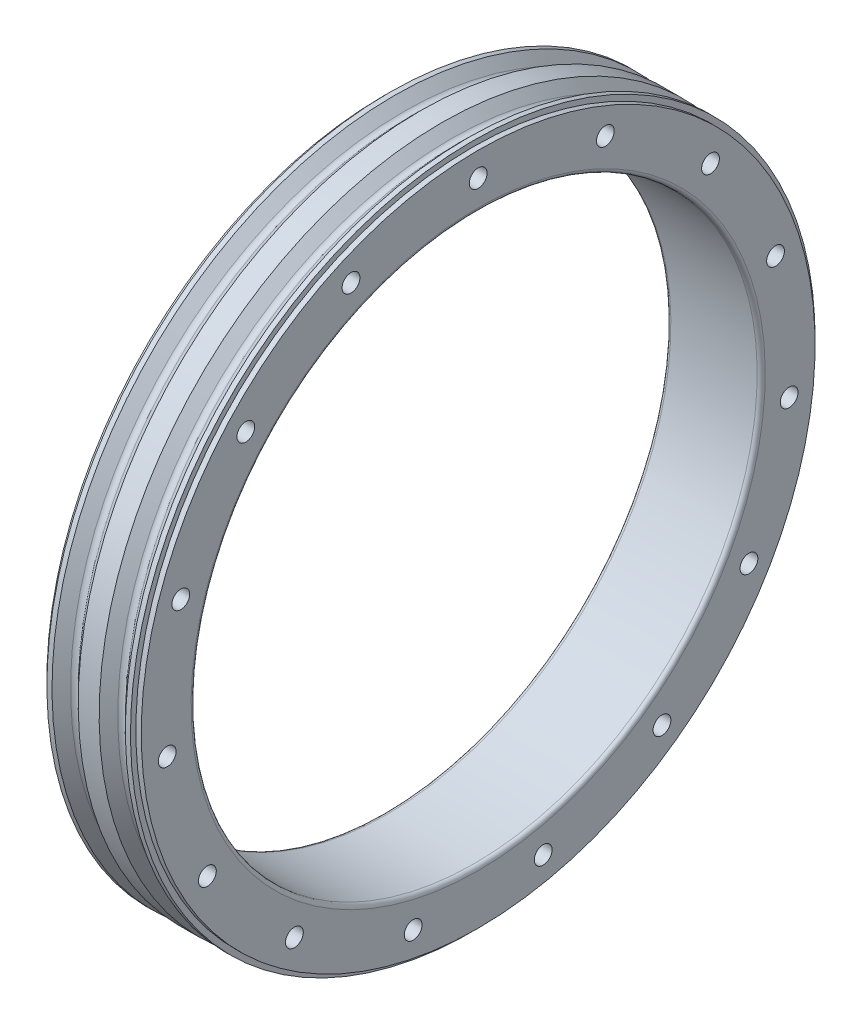
from build123d import *

# Parameters (mm, degrees)
FILLET1_R                               = 2
CBORE_FOR_M6_HEX_HEAD_BOLT1_D           = 6.6
CBORE_FOR_M6_HEX_HEAD_BOLT1_CBORE_D     = 14.547
CBORE_FOR_M6_HEX_HEAD_BOLT1_CBORE_DEPTH = 4
CIRPATTERN1_COUNT                       = 15
CUT_EXTRUDE2_START                      = -2
SKETCH7_R                               = 127
SKETCH7_R_2                             = 125
CUT_EXTRUDE2_DEPTH                      = 2
FILLET2_R                               = 1.5


with BuildPart() as part:
    # Sketch2 → Revolve1 (revolve)
    with BuildSketch(Plane.XY):
        Polygon((17.5, 105), (17.5, 127), (13.613961031, 127), (8.75, 122.136038969), (3.886038969, 127), (-3.886038969, 127), (-8.75, 122.136038969), (-13.613961031, 127), (-17.5, 127), (-17.5, 105), align=None)
    revolve(axis=Axis((0, 0, 0), (-1, 0, 0)))

    # Fillet1
    fillet1_edges = [part.edges().sort_by_distance(p)[0] for p in [
        (8.75, -122.136038969, 0),
        (-8.75, -122.136038969, 0),
    ]]
    fillet(fillet1_edges, radius=FILLET1_R)

    # CBORE for M6 Hex Head Bolt1 (through all)
    with Locations(Plane(origin=(-17.5, 116, 0), x_dir=(0, -1, 0), z_dir=(-1, 0, 0))):
        with Locations((0, 0)):
            cbore_for_m6_hex_head_bolt1 = CounterBoreHole(CBORE_FOR_M6_HEX_HEAD_BOLT1_D / 2, CBORE_FOR_M6_HEX_HEAD_BOLT1_CBORE_D / 2, CBORE_FOR_M6_HEX_HEAD_BOLT1_CBORE_DEPTH)

    # CirPattern1: CBORE for M6 Hex Head Bolt1 ×15 about axis
    cirpattern1_axis = Axis((-17.5, 0, 0), (1, 0, 0))
    for i in range(1, CIRPATTERN1_COUNT):
        add(cbore_for_m6_hex_head_bolt1.rotate(cirpattern1_axis, i * 360 / CIRPATTERN1_COUNT), mode=Mode.SUBTRACT)

    # Sketch7 → Cut-Extrude2 (cut)
    with BuildSketch(Plane(origin=(17.5, 0, 0), x_dir=(0, 0, -1), z_dir=(1, 0, 0)).offset(CUT_EXTRUDE2_START)):
        Circle(SKETCH7_R)
        Circle(SKETCH7_R_2, mode=Mode.SUBTRACT)
    cut_extrude2 = extrude(amount=CUT_EXTRUDE2_DEPTH, mode=Mode.SUBTRACT)

    # Mirror1: Cut-Extrude2 across plane
    add(cut_extrude2.mirror(Plane(origin=(0, 0, 0), x_dir=(0, 0, 1), z_dir=(1, 0, 0))), mode=Mode.SUBTRACT)

    # Fillet2
    fillet2_edges = [part.edges().sort_by_distance(p)[0] for p in [
        (-17.5, -105, 0),
        (17.5, -105, 0),
    ]]
    fillet(fillet2_edges, radius=FILLET2_R)


solid = part.part
